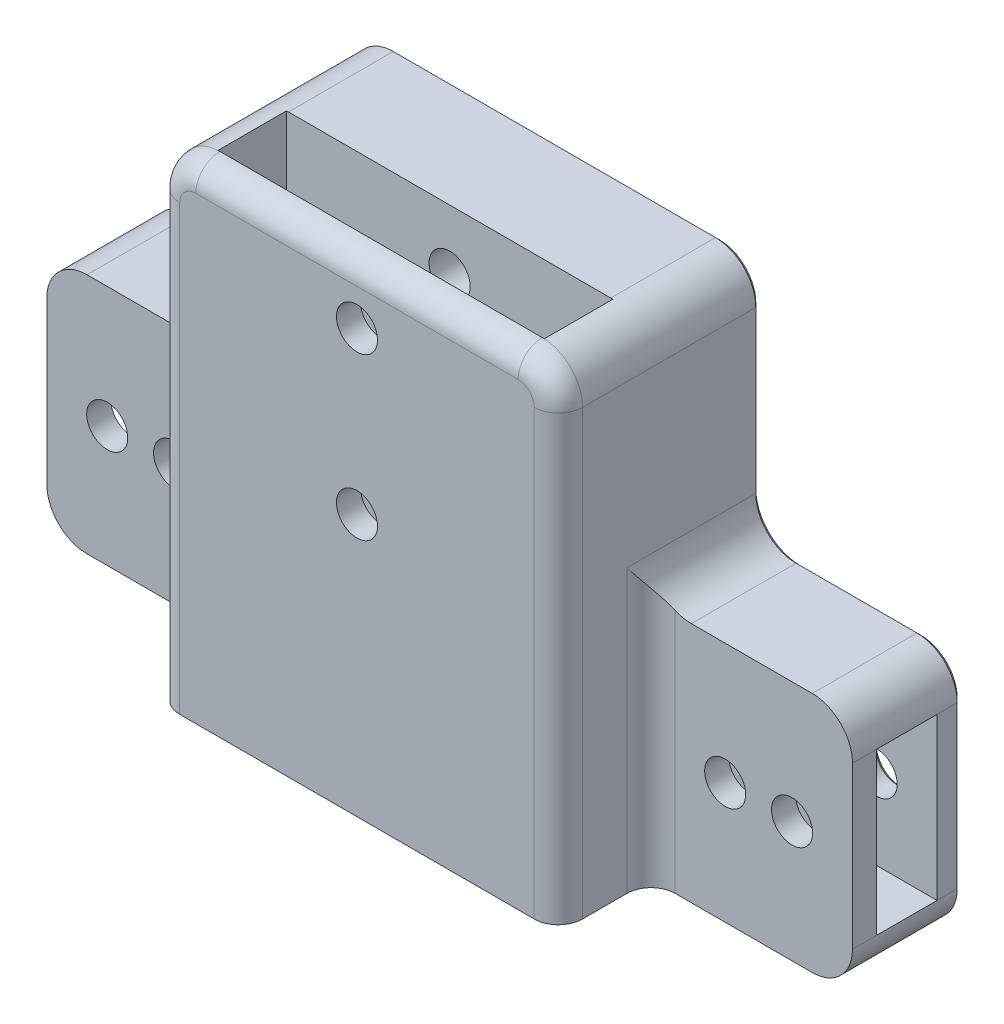
from build123d import *

# Parameters (mm, degrees)
BOSS_EXTRUDE1_DEPTH     = 12.5
SKETCH3_W               = 25
SKETCH3_H               = 11.5
CUT_EXTRUDE2_DEPTH      = 60.634302209
CUT_EXTRUDE1_DEPTH      = 60.634302209
CUT_EXTRUDE1_DEPTH_BACK = 60.634302209
SKETCH2_W               = 20.25
SKETCH2_H               = 8.5
SKETCH4_W               = 7.5
SKETCH4_H               = 20
CUT_EXTRUDE3_DEPTH      = 60.634302209
SKETCH8_R               = 2.55
PIN_HOLE_DEPTH          = 64.442887702
SKETCH9_R               = 3.5
COUNTERBORE_DEPTH       = 9
SKETCH7_R               = 2.55
CUT_EXTRUDE5_DEPTH      = 60.851900555
LPATTERN1_COUNT         = 2
LPATTERN1_PITCH         = 8.3
MIRROR2_COPY_1_SKETCH_R = 2.55
MIRROR2_COPY_1_DEPTH    = 60.851900555
FILLET1_R               = 5
CHAMFER1_SIZE           = 0.5
FILLET2_R               = 3


# Some blends are built 0.0001 mm under size
with BuildPart() as part:
    # Sketch1 → Boss-Extrude1 (new, symmetric)
    with BuildSketch(Plane.XY):
        Polygon((25, -30), (0, -30), (0, 30), (25, 30), (25, 0), (50, 0), (50, -30), align=None)
    extrude(amount=BOSS_EXTRUDE1_DEPTH, both=True)

    # Sketch3 → Cut-Extrude2 (cut, through all)
    with BuildSketch(Plane(origin=(0, 0, 0), x_dir=(1, 0, 0), z_dir=(0, 1, 0))):
        with Locations((37.5, -6.75)):
            Rectangle(SKETCH3_W, SKETCH3_H)
    extrude(amount=-CUT_EXTRUDE2_DEPTH, mode=Mode.SUBTRACT)

    # Sketch2 → Cut-Extrude1 (cut, two sides: drawn at the far end of the back side and taken through both)
    with BuildSketch(Plane(origin=(0, 0, 0), x_dir=(1, 0, 0), z_dir=(0, 1, 0)).offset(-CUT_EXTRUDE1_DEPTH_BACK)):
        with Locations((10.125, -5.25)):
            Rectangle(SKETCH2_W, SKETCH2_H)
    extrude(amount=CUT_EXTRUDE1_DEPTH + CUT_EXTRUDE1_DEPTH_BACK, mode=Mode.SUBTRACT)

    # Sketch4 → Cut-Extrude3 (cut, through all)
    with BuildSketch(Plane(origin=(50, 0, 0), x_dir=(0, 0, -1), z_dir=(1, 0, 0))):
        with Locations((5.75, -15)):
            Rectangle(SKETCH4_W, SKETCH4_H)
    extrude(amount=-CUT_EXTRUDE3_DEPTH, mode=Mode.SUBTRACT)

    # Mirror1: part across plane


with BuildPart() as part_1:
    add(part.part)
    add(part.part.mirror(Plane(origin=(0, 0, 0), x_dir=(0, 0, 1), z_dir=(1, 0, 0))))

    # Sketch8 → Pin Hole (cut, through all)
    with BuildSketch(Plane.XY.offset(12.5)):
        with Locations((0, 22.5)):
            Circle(SKETCH8_R)
        with Locations((0, 2.5)):
            Circle(SKETCH8_R)
    extrude(amount=-PIN_HOLE_DEPTH, mode=Mode.SUBTRACT)

    # Sketch9 → Counterbore (cut)
    with BuildSketch(Plane(origin=(0, 0, -12.5), x_dir=(-1, 0, 0), z_dir=(0, 0, -1))):
        with Locations((0, 22.5)):
            Circle(SKETCH9_R)
        with Locations((0, 2.5)):
            Circle(SKETCH9_R)
    extrude(amount=-COUNTERBORE_DEPTH, mode=Mode.SUBTRACT)

    # Sketch7 → Cut-Extrude5 (cut, through all)
    with BuildSketch(Plane.XY.offset(1)):
        with Locations((42.5, -15)):
            Circle(SKETCH7_R)
    cut_extrude5 = extrude(amount=-CUT_EXTRUDE5_DEPTH, mode=Mode.SUBTRACT)

    # LPattern1: Cut-Extrude5 ×2
    with Locations(*[(-i * LPATTERN1_PITCH, 0, 0) for i in range(1, LPATTERN1_COUNT)]):
        add(cut_extrude5, mode=Mode.SUBTRACT)

    # Mirror2: Cut-Extrude5 across plane
    add(cut_extrude5.mirror(Plane(origin=(0, 0, 0), x_dir=(0, 0, 1), z_dir=(1, 0, 0))), mode=Mode.SUBTRACT)

    # Mirror2 copy 1 sketch → Mirror2 copy 1 (cut, through all)
    with BuildSketch(Plane(origin=(8.3, 0, 1), x_dir=(-1, 0, 0), z_dir=(0, 0, 1))):
        with Locations((42.5, 15)):
            Circle(MIRROR2_COPY_1_SKETCH_R)
    extrude(amount=-MIRROR2_COPY_1_DEPTH, mode=Mode.SUBTRACT)

    # Fillet1
    # the kernel refuses this fillet: 5 mm, written as the material it adds along each edge
    with BuildSketch(Plane(origin=(-25, 0, 1), x_dir=(0, 1, 0), z_dir=(0, 0, -1))) as fillet1_piece_1:
        with BuildLine():
            CenterArc((FILLET1_R, -FILLET1_R), FILLET1_R, 90, 90)
            Line((0, -FILLET1_R), (0, 0))
            Line((0, 0), (FILLET1_R, 0))
        make_face()
    extrude(amount=13.5)
    with BuildSketch(Plane(origin=(25, 0, 1), x_dir=(0, 1, 0), z_dir=(0, 0, -1))) as fillet1_piece_2:
        with BuildLine():
            CenterArc((FILLET1_R, FILLET1_R), FILLET1_R, 180, 90)
            Line((0, FILLET1_R), (0, 0))
            Line((0, 0), (FILLET1_R, 0))
        make_face()
    extrude(amount=13.5)
    # the kernel refuses this fillet: 5 mm, written as the material it takes off along each edge
    with BuildSketch(Plane(origin=(25, 30, 25), x_dir=(0, -1, 0), z_dir=(0, 0, -1)), Plane(origin=(-25, 30, 25), x_dir=(1, 0, 0), z_dir=(0, 0, -1))) as fillet1_2_piece_1:
        with BuildLine():
            CenterArc((FILLET1_R, FILLET1_R), FILLET1_R, 180, 90)
            Line((0, FILLET1_R), (0, 0))
            Line((0, 0), (FILLET1_R, 0))
        make_face()
    extrude(amount=50, mode=Mode.SUBTRACT)
    with BuildSketch(Plane(origin=(-50, 0, -25), x_dir=(1, 0, 0), z_dir=(0, 0, 1)), Plane(origin=(50, 0, -25), x_dir=(0, -1, 0), z_dir=(0, 0, 1)), Plane(origin=(50, -30, -25), x_dir=(-1, 0, 0), z_dir=(0, 0, 1))) as fillet1_2_piece_2:
        with BuildLine():
            CenterArc((FILLET1_R, -FILLET1_R), FILLET1_R, 90, 90)
            Line((0, -FILLET1_R), (0, 0))
            Line((0, 0), (FILLET1_R, 0))
        make_face()
    extrude(amount=38.5, mode=Mode.SUBTRACT)
    with BuildSketch(Plane(origin=(-50, -30, -25), x_dir=(1, 0, 0), z_dir=(0, 0, 1))) as fillet1_2_piece_3:
        with BuildLine():
            CenterArc((FILLET1_R, FILLET1_R), FILLET1_R, 180, 90)
            Line((0, FILLET1_R), (0, 0))
            Line((0, 0), (FILLET1_R, 0))
        make_face()
    extrude(amount=38.5, mode=Mode.SUBTRACT)

    # Chamfer1
    chamfer1_edges = [part_1.edges().sort_by_distance(p)[0] for p in [
        (3.5, 22.5, -12.5),
        (3.5, 2.5, -12.5),
        (39.95, -15, -12.5),
        (31.65, -15, -12.5),
        (-39.95, -15, -12.5),
        (-31.65, -15, -12.5),
        (0, -30, -12.5),
        (-50, -15, -12.5),
        (-37.5, 0, -12.5),
        (-25, 15, -12.5),
        (0, 30, -12.5),
        (25, 15, -12.5),
        (37.5, 0, -12.5),
        (50, -15, -12.5),
        (48.535533906, -1.464466094, -12.5),
        (-48.535533906, -1.464466094, -12.5),
        (-23.535533906, 28.535533906, -12.5),
        (23.535533906, 28.535533906, -12.5),
        (48.535533906, -28.535533906, -12.5),
        (-48.535533906, -28.535533906, -12.5),
        (-26.464466094, 1.464466094, -12.5),
        (26.464466094, 1.464466094, -12.5),
    ]]
    chamfer(chamfer1_edges, length=CHAMFER1_SIZE)

    # Fillet2
    fillet2_edges = [part_1.edges().sort_by_distance(p)[0] for p in [
        (0, 30, 12.5),
        (-23.535533906, 28.535533906, 12.5),
        (23.535533906, 28.535533906, 12.5),
        (25, -2.5, 12.5),
        (25, -12.5, 1),
        (-25, -2.5, 12.5),
        (-25, -12.5, 1),
    ]]
    fillet(fillet2_edges, radius=FILLET2_R - 0.0001)  # a hair under: the kernel refuses the full size


solid = part_1.part
